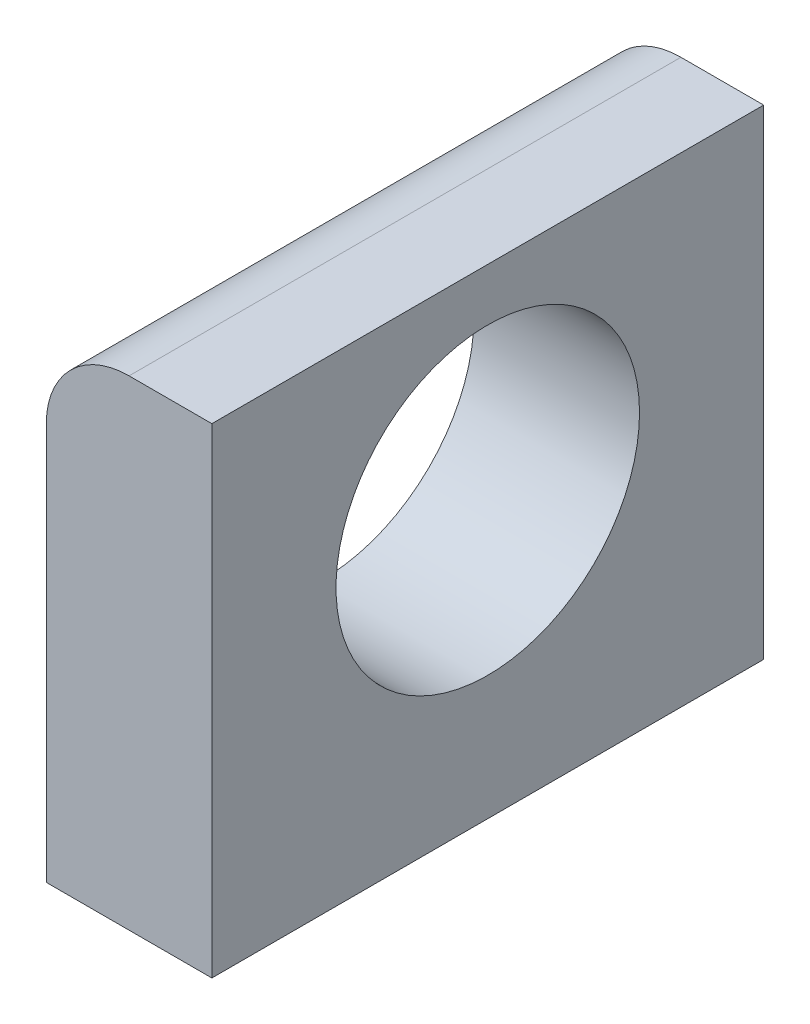
from build123d import *

# Parameters (mm, degrees)
SKETCH_1_W          = 3
SKETCH_1_H          = 8.7
EXTRUDE_1_DEPTH     = 10
SKETCH_2_R          = 2.75
CUT_EXTRUDE_1_DEPTH = 10
FILLET_1_R          = 1.5


with BuildPart() as part:
    # 草图1 → 凸台-拉伸1 (new body)
    with BuildSketch(Plane.XY):
        Rectangle(SKETCH_1_W, SKETCH_1_H)
    extrude(amount=EXTRUDE_1_DEPTH)

    # 草图2 → 切除-拉伸1 (cut)
    with BuildSketch(Plane(origin=(1.5, 0, 0), x_dir=(0, 0, -1), z_dir=(1, 0, 0))):
        with Locations((-5, 0.65)):
            Circle(SKETCH_2_R)
    extrude(amount=-CUT_EXTRUDE_1_DEPTH, mode=Mode.SUBTRACT)

    # 圆角1
    # the kernel refuses this fillet: 1.5 mm, written as the material it takes off along each edge
    with BuildSketch(Plane(origin=(-1.5, 4.35, -3.75), x_dir=(0, -1, 0), z_dir=(0, 0, 1))) as fillet_1_piece_1:
        with BuildLine():
            CenterArc((FILLET_1_R, FILLET_1_R), FILLET_1_R, 180, 90)
            Line((0, FILLET_1_R), (0, 0))
            Line((0, 0), (FILLET_1_R, 0))
        make_face()
    extrude(amount=17.5, mode=Mode.SUBTRACT)


solid = part.part
